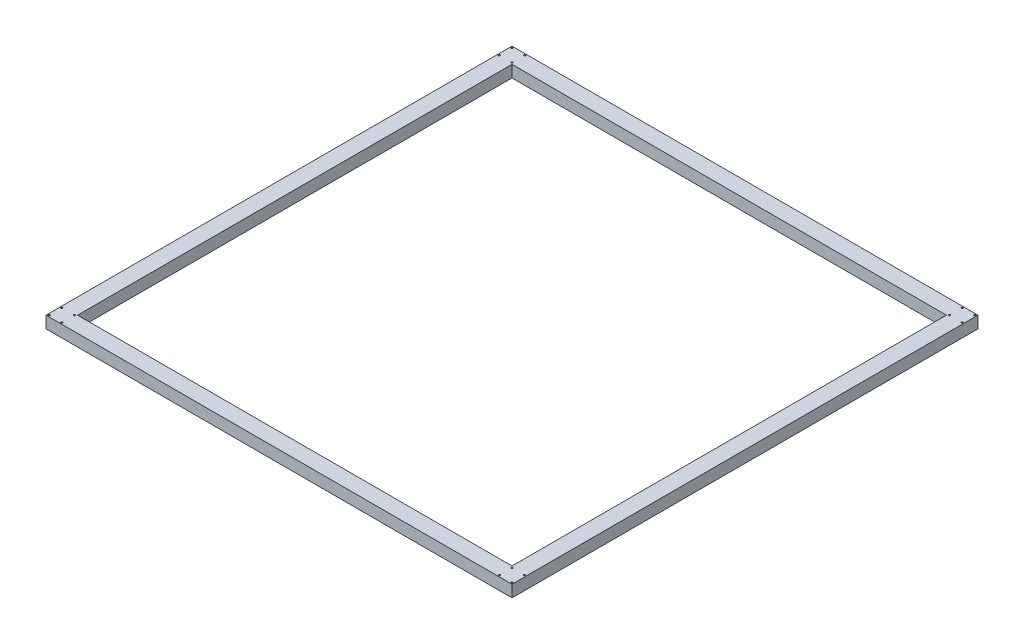
from build123d import *

# Parameters (mm, degrees)
ESBO_O1_W                = 5900
ESBO_O1_H                = 5900
ESBO_O1_R                = 10
ESBO_O1_W_2              = 5500
ESBO_O1_H_2              = 5500
RESSALTO_EXTRUS_O1_DEPTH = 150


with BuildPart() as part:
    # Esboço1 → Ressalto-extrusão1 (new body)
    with BuildSketch(Plane(origin=(0, 0, 0), x_dir=(1, 0, 0), z_dir=(0, 1, 0))):
        Rectangle(ESBO_O1_W, ESBO_O1_H)
        with Locations((-2770, 2770)):
            Circle(ESBO_O1_R, mode=Mode.SUBTRACT)
        with Locations((-2930, 2770)):
            Circle(ESBO_O1_R, mode=Mode.SUBTRACT)
        with Locations((-2930, 2930)):
            Circle(ESBO_O1_R, mode=Mode.SUBTRACT)
        with Locations((-2770, 2930)):
            Circle(ESBO_O1_R, mode=Mode.SUBTRACT)
        with Locations((2930, 2770)):
            Circle(ESBO_O1_R, mode=Mode.SUBTRACT)
        with Locations((2930, 2930)):
            Circle(ESBO_O1_R, mode=Mode.SUBTRACT)
        with Locations((2770, 2770)):
            Circle(ESBO_O1_R, mode=Mode.SUBTRACT)
        with Locations((2770, 2930)):
            Circle(ESBO_O1_R, mode=Mode.SUBTRACT)
        with Locations((2930, -2930)):
            Circle(ESBO_O1_R, mode=Mode.SUBTRACT)
        with Locations((2770, -2930)):
            Circle(ESBO_O1_R, mode=Mode.SUBTRACT)
        with Locations((2930, -2770)):
            Circle(ESBO_O1_R, mode=Mode.SUBTRACT)
        with Locations((2770, -2770)):
            Circle(ESBO_O1_R, mode=Mode.SUBTRACT)
        with Locations((-2770, -2930)):
            Circle(ESBO_O1_R, mode=Mode.SUBTRACT)
        with Locations((-2930, -2930)):
            Circle(ESBO_O1_R, mode=Mode.SUBTRACT)
        with Locations((-2770, -2770)):
            Circle(ESBO_O1_R, mode=Mode.SUBTRACT)
        with Locations((-2930, -2770)):
            Circle(ESBO_O1_R, mode=Mode.SUBTRACT)
        Rectangle(ESBO_O1_W_2, ESBO_O1_H_2, mode=Mode.SUBTRACT)
    extrude(amount=RESSALTO_EXTRUS_O1_DEPTH)


solid = part.part
